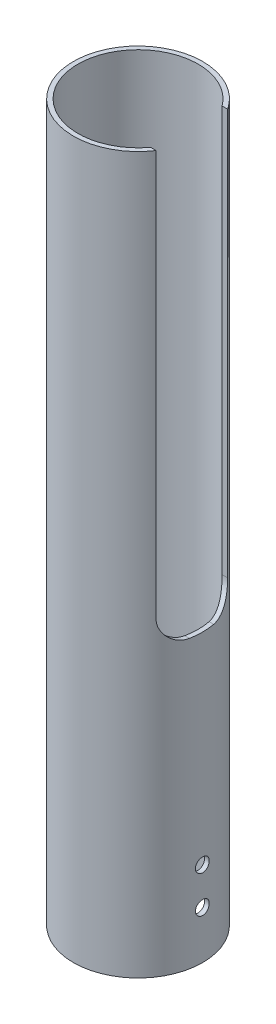
from build123d import *

# Parameters (mm, degrees)
SKETCH1_R               = 27.1
SKETCH1_R_2             = 25.2
BOSS_EXTRUDE1_DEPTH     = 300
CUT_EXTRUDE1_DEPTH      = 303.438125903
CUT_EXTRUDE1_DEPTH_BACK = 303.438125903
SKETCH2_R               = 2.9
CUT_EXTRUDE2_DEPTH      = 303.438126021


with BuildPart() as part:
    # Sketch1 → Boss-Extrude1 (new body)
    with BuildSketch(Plane(origin=(0, 0, 0), x_dir=(1, 0, 0), z_dir=(0, 1, 0))):
        Circle(SKETCH1_R)
        Circle(SKETCH1_R_2, mode=Mode.SUBTRACT)
    extrude(amount=BOSS_EXTRUDE1_DEPTH)

    # Sketch2 → Cut-Extrude1 (cut, two sides: drawn at the far end of the back side and taken through both)
    with BuildSketch(Plane(origin=(0, 0, 0), x_dir=(0, 0, -1), z_dir=(1, 0, 0)).offset(-CUT_EXTRUDE1_DEPTH_BACK)):
        with Locations((0, 20)):
            Circle(SKETCH2_R)
        with Locations((0, 35.5)):
            Circle(SKETCH2_R)
    extrude(amount=CUT_EXTRUDE1_DEPTH + CUT_EXTRUDE1_DEPTH_BACK, mode=Mode.SUBTRACT)

    # Sketch3 → Cut-Extrude2 (cut, through all)
    with BuildSketch(Plane(origin=(0, 0, 0), x_dir=(0, 0, -1), z_dir=(1, 0, 0))):
        with BuildLine():
            Line((0, 300), (-15, 300))
            Line((-15, 300), (-15, 129.9))
            ThreePointArc((-15, 129.9), (-12.100357134, 122.899642866), (-5.1, 120))
            Line((-5.1, 120), (5.1, 120))
            ThreePointArc((5.1, 120), (12.100357134, 122.899642866), (15, 129.9))
            Line((15, 129.9), (15, 300))
            Line((15, 300), (0, 300))
        make_face()
    extrude(amount=CUT_EXTRUDE2_DEPTH, mode=Mode.SUBTRACT)


solid = part.part
